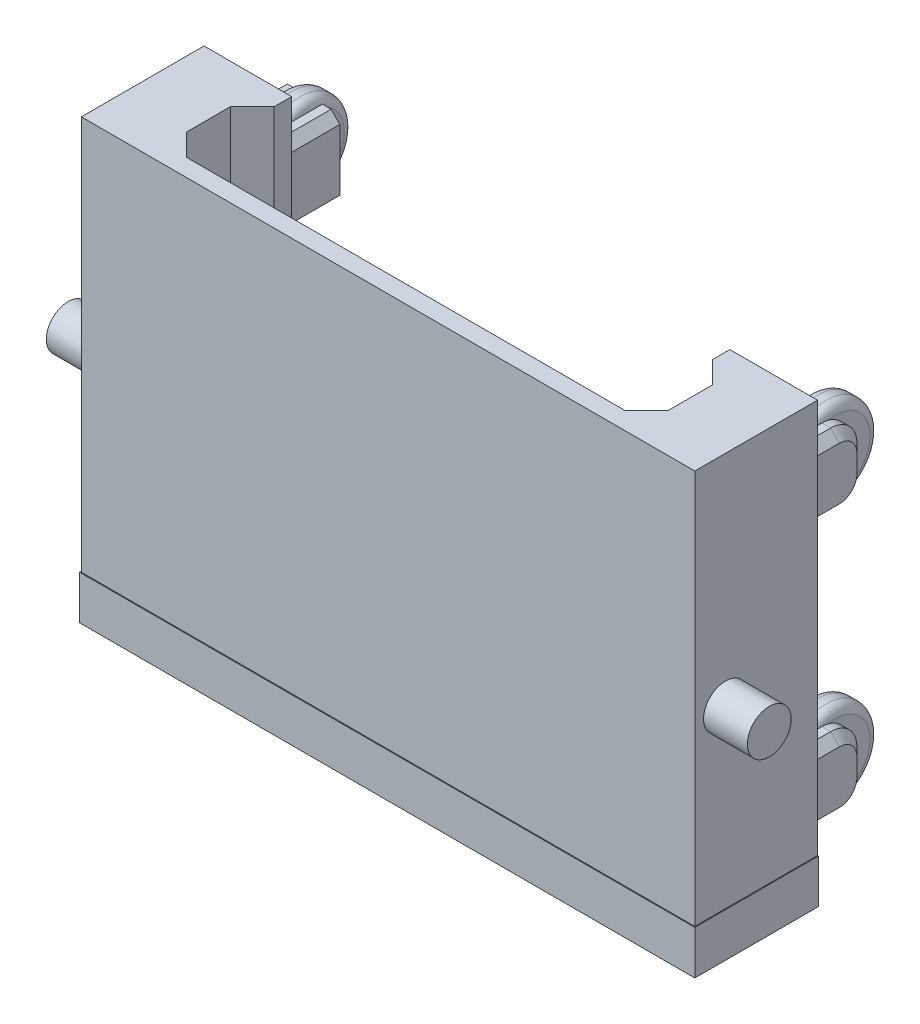
from build123d import *

# Parameters (mm, degrees)
SKETCH1_W             = 700
SKETCH1_H             = 500
BOSS_EXTRUDE1_DEPTH   = 70
CUT_EXTRUDE1_DEPTH    = 615.328902136
SKETCH3_R             = 25
BOSS_EXTRUDE2_DEPTH   = 50
BOSS_EXTRUDE3_START   = 50
SKETCH4_R             = 25
BOSS_EXTRUDE3_DEPTH   = 50
BOSS_EXTRUDE4_DEPTH   = 500
BOSS_EXTRUDE5_DEPTH   = 500
SKETCH7_W             = 20
SKETCH7_H             = 80
BOSS_EXTRUDE6_DEPTH   = 70
FILLET1_R             = 30
SKETCH8_R             = 50
BOSS_EXTRUDE8_DEPTH   = 30
BOSS_EXTRUDE8_2_DEPTH = 30
FILLET2_R             = 10
FILLET3_R             = 10
CHAMFER1_SIZE         = 10
MIRROR1_START         = -140
MIRROR1_DEPTH         = 70
SKETCH9_W             = 700
SKETCH9_H             = 50
BOSS_EXTRUDE9_DEPTH   = 1
SKETCH10_W            = 141
SKETCH10_H            = 50
BOSS_EXTRUDE10_DEPTH  = 1


# Read off the part's stored shape, not the designer's step: Mirror1
with BuildPart() as part:
    # Sketch1 → Boss-Extrude1 (new body)
    with BuildSketch(Plane.XY):
        Rectangle(SKETCH1_W, SKETCH1_H)
    extrude(amount=BOSS_EXTRUDE1_DEPTH)

    # Sketch2 → Cut-Extrude1 (cut, through all)
    with BuildSketch(Plane.XZ.offset(250)):
        Polygon((-300, 0), (-250, 50), (250, 50), (300, 0), align=None)
    extrude(amount=-CUT_EXTRUDE1_DEPTH, mode=Mode.SUBTRACT)

    # Sketch3 → Boss-Extrude2 (add)
    with BuildSketch(Plane.ZY.offset(350)):
        with Locations(Location((35, 0, 0), (0, 0, 180))):
            Circle(SKETCH3_R)
    extrude(amount=BOSS_EXTRUDE2_DEPTH)

    # Sketch4 → Boss-Extrude3 (add)
    with BuildSketch(Plane(origin=(350, 0, 0), x_dir=(0, 0, -1), z_dir=(1, 0, 0)).offset(BOSS_EXTRUDE3_START)):
        with Locations((-35, 0)):
            Circle(SKETCH4_R)
    extrude(amount=-BOSS_EXTRUDE3_DEPTH)

    # Sketch5 → Boss-Extrude4 (add)
    with BuildSketch(Plane.XZ.offset(250)):
        Polygon((-350, 0), (-350, -50), (-350, -70), (-250, -70), (-250, -50), (-300, 0), align=None)
        Polygon((350, 0), (350, -50), (350, -70), (250, -70), (250, -50), (300, 0), align=None)
    extrude(amount=-BOSS_EXTRUDE4_DEPTH)

    # Sketch6 → Boss-Extrude5 (add)
    with BuildSketch(Plane.XZ.offset(250)):
        Polygon((-275, 25), (-275, -25), (-300, 0), align=None)
        Polygon((275, 25), (275, -25), (300, 0), align=None)
    extrude(amount=-BOSS_EXTRUDE5_DEPTH)

    # Sketch7 → Boss-Extrude6 (add)
    with BuildSketch(Plane(origin=(0, 0, -70), x_dir=(-1, 0, 0), z_dir=(0, 0, -1))):
        with Locations((-275, 150)):
            Rectangle(SKETCH7_W, SKETCH7_H)
        with Locations((-325, 150)):
            Rectangle(SKETCH7_W, SKETCH7_H)
        with Locations((-275, -150)):
            Rectangle(SKETCH7_W, SKETCH7_H)
        with Locations((-325, -150)):
            Rectangle(SKETCH7_W, SKETCH7_H)
    extrude(amount=BOSS_EXTRUDE6_DEPTH)

    # Fillet1
    fillet1_edges = [part.edges().sort_by_distance(p)[0] for p in [
        (325, 190, -140),
        (325, 110, -140),
        (275, -110, -140),
        (275, -190, -140),
        (325, -110, -140),
        (325, -190, -140),
        (275, 190, -140),
        (275, 110, -140),
    ]]
    fillet(fillet1_edges, radius=FILLET1_R)

    # Chamfer1
    chamfer1_edges = [part.edges().sort_by_distance(p)[0] for p in [
        (335, 190, -90),
        (335, 150, -140),
        (335, 110, -90),
        (335, 118.786796564, -131.213203436),
        (335, 181.213203436, -131.213203436),
        (265, 190, -90),
        (265, 150, -140),
        (265, 110, -90),
        (265, 118.786796564, -131.213203436),
        (265, 181.213203436, -131.213203436),
        (335, -110, -90),
        (335, -150, -140),
        (335, -190, -90),
        (335, -181.213203436, -131.213203436),
        (335, -118.786796564, -131.213203436),
        (265, -110, -90),
        (265, -150, -140),
        (265, -190, -90),
        (265, -181.213203436, -131.213203436),
        (265, -118.786796564, -131.213203436),
    ]]
    chamfer(chamfer1_edges, length=CHAMFER1_SIZE)

    # Mirror1 outline → Mirror1 (add)
    with BuildSketch(Plane.XY.offset(MIRROR1_START)):
        Polygon((-285, 190), (-285, 110), (-265, 110), (-265, 180), (-275, 190), align=None)
        Polygon((-335, 180), (-335, 110), (-315, 110), (-315, 190), (-325, 190), align=None)
        Polygon((-285, -110), (-285, -190), (-265, -190), (-265, -120), (-275, -110), align=None)
        Polygon((-335, -120), (-335, -190), (-315, -190), (-315, -110), (-325, -110), align=None)
    extrude(amount=MIRROR1_DEPTH)

    # Sketch9 → Boss-Extrude9 (add)
    with BuildSketch(Plane.XY.offset(70)):
        with Locations((0, -225)):
            Rectangle(SKETCH9_W, SKETCH9_H)
    extrude(amount=BOSS_EXTRUDE9_DEPTH)

    # Sketch10 → Boss-Extrude10 (add)
    with BuildSketch(Plane(origin=(350, 0, 0), x_dir=(0, 0, -1), z_dir=(1, 0, 0))):
        with Locations((-0.5, -225)):
            Rectangle(SKETCH10_W, SKETCH10_H)
    boss_extrude10 = extrude(amount=BOSS_EXTRUDE10_DEPTH)

    # Mirror3: Boss-Extrude10 across plane
    add(boss_extrude10.mirror(Plane(origin=(0, 0, 0), x_dir=(0, 0, 1), z_dir=(1, 0, 0))))


with BuildPart() as body_2:
    # Sketch8 → Boss-Extrude8 (new body)
    with BuildSketch(Plane(origin=(285, 0, 0), x_dir=(0, 0, -1), z_dir=(1, 0, 0))):
        with Locations((125, -150)):
            Circle(SKETCH8_R)
    extrude(amount=BOSS_EXTRUDE8_DEPTH)

    # Fillet2
    fillet2_edges = [body_2.edges().sort_by_distance(p)[0] for p in [
        (285, -150, -75),
        (315, -150, -75),
    ]]
    fillet(fillet2_edges, radius=FILLET2_R)


with BuildPart() as body_3:
    # Sketch8 → Boss-Extrude8 2 (new body)
    with BuildSketch(Plane(origin=(285, 0, 0), x_dir=(0, 0, -1), z_dir=(1, 0, 0))):
        with Locations((125, 150)):
            Circle(SKETCH8_R)
    extrude(amount=BOSS_EXTRUDE8_2_DEPTH)

    # Fillet3
    fillet3_edges = [body_3.edges().sort_by_distance(p)[0] for p in [
        (285, 150, -75),
        (315, 150, -75),
    ]]
    fillet(fillet3_edges, radius=FILLET3_R)


with BuildPart() as body_4:
    # Mirror2: mirrored copy
    add(body_3.part.mirror(Plane(origin=(0, 0, 0), x_dir=(0, 0, 1), z_dir=(1, 0, 0))))


with BuildPart() as body_5:
    # Mirror2 2: mirrored copy
    add(body_2.part.mirror(Plane(origin=(0, 0, 0), x_dir=(0, 0, 1), z_dir=(1, 0, 0))))


solid = Compound([part.part, body_2.part, body_3.part, body_4.part, body_5.part])
